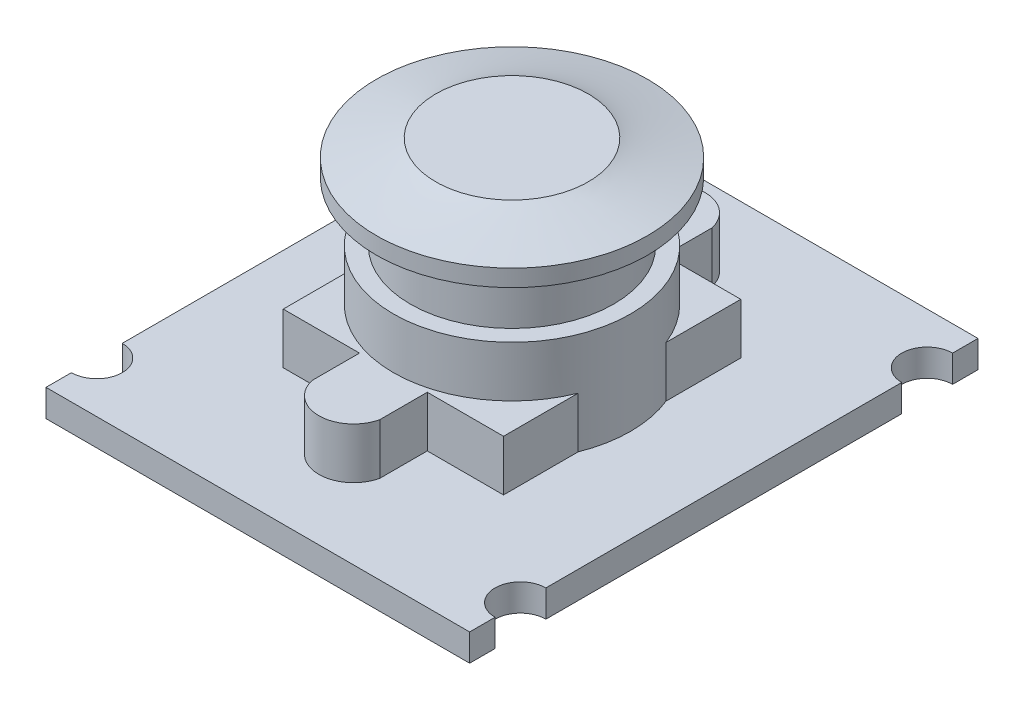
from build123d import *

# Parameters (mm, degrees)
SKETCH1_W               = 25
SKETCH1_H               = 30
BOSS_EXTRUDE1_DEPTH     = 1.6
BOSS_EXTRUDE2_DEPTH     = 3
SKETCH3_R               = 7
BOSS_EXTRUDE3_DEPTH     = 3
BOSS_EXTRUDE4_START     = 3
SKETCH4_R               = 7
BOSS_EXTRUDE4_DEPTH     = 3
SKETCH5_R               = 6
BOSS_EXTRUDE5_DEPTH     = 3.5
SKETCH6_R               = 8
BOSS_EXTRUDE6_DEPTH     = 1
SKETCH10_R              = 1.5
CUT_EXTRUDE1_DEPTH      = 2
MIRROR2_COPY_1_SKETCH_R = 1.5
MIRROR2_COPY_1_DEPTH    = 2
SKETCH11_W              = 4.4
SKETCH11_H              = 7.4
BOSS_EXTRUDE7_DEPTH     = 3.2
CUT_EXTRUDE2_DEPTH      = 3
SKETCH13_W              = 7.4
SKETCH13_H              = 0.01
CUT_EXTRUDE3_DEPTH      = 3


with BuildPart() as part:
    # Sketch1 → Boss-Extrude1 (new body)
    with BuildSketch(Plane(origin=(0, 0, 0), x_dir=(1, 0, 0), z_dir=(0, 1, 0))):
        Rectangle(SKETCH1_W, SKETCH1_H)
    extrude(amount=BOSS_EXTRUDE1_DEPTH)

    # Sketch2 → Boss-Extrude2 (add)
    with BuildSketch(Plane(origin=(0, 1.6, 0), x_dir=(1, 0, 0), z_dir=(0, 1, 0))):
        with BuildLine():
            Line((2, -9.8), (2, -7))
            Line((2, -7), (6.5, -7))
            Line((6.5, -7), (6.5, 7))
            Line((6.5, 7), (2, 7))
            Line((2, 7), (2, 9.8))
            ThreePointArc((2, 9.8), (0, 11.4), (-2, 9.8))
            Line((-2, 9.8), (-2, 7))
            Line((-2, 7), (-6.5, 7))
            Line((-6.5, 7), (-6.5, -7))
            Line((-6.5, -7), (-2, -7))
            Line((-2, -7), (-2, -9.8))
            ThreePointArc((-2, -9.8), (0, -11.4), (2, -9.8))
        make_face()
    extrude(amount=BOSS_EXTRUDE2_DEPTH)

    # Sketch3 → Boss-Extrude3 (add)
    with BuildSketch(Plane(origin=(0, 4.6, 0), x_dir=(1, 0, 0), z_dir=(0, 1, 0))):
        Circle(SKETCH3_R)
    extrude(amount=-BOSS_EXTRUDE3_DEPTH)

    # Sketch4 → Boss-Extrude4 (add)
    with BuildSketch(Plane(origin=(0, 4.6, 0), x_dir=(1, 0, 0), z_dir=(0, 1, 0)).offset(BOSS_EXTRUDE4_START)):
        with Locations(Location((0, 0, 0), (0, 0, 270))):
            Circle(SKETCH4_R)
    extrude(amount=-BOSS_EXTRUDE4_DEPTH)

    # Sketch5 → Boss-Extrude5 (add)
    with BuildSketch(Plane(origin=(0, 7.6, 0), x_dir=(1, 0, 0), z_dir=(0, 1, 0))):
        with Locations(Location((0, 0, 0), (0, 0, 270))):
            Circle(SKETCH5_R)
    extrude(amount=BOSS_EXTRUDE5_DEPTH)

    # Sketch6 → Boss-Extrude6 (add)
    with BuildSketch(Plane(origin=(0, 11.1, 0), x_dir=(1, 0, 0), z_dir=(0, 1, 0))):
        with Locations(Location((0, 0, 0), (0, 0, 270))):
            Circle(SKETCH6_R)
    extrude(amount=BOSS_EXTRUDE6_DEPTH)

    # Loft1: read off the stored shape, not the designer's step
    # Loft1: loft between two sections, ruled curve by curve
    loft1_from = [
        Edge.make_bspline([(-7.29329327, 12.1, -3.287533007), (-13.868359284, 12.1, 11.299053534), (0.718227257, 12.1, 17.874119548), (7.29329327, 12.1, 3.287533007), (13.868359284, 12.1, -11.299053534), (-0.718227257, 12.1, -17.874119548), (-7.29329327, 12.1, -3.287533007)], [0, 0, 0, 0, 0.5, 0.5, 0.5, 1, 1, 1, 1], 3, [1, 0.333333333, 0.333333333, 1, 0.333333333, 0.333333333, 1]),
    ]
    loft1_to = [
        Edge.make_bspline([(-4.457852082, 13.1, 0.614454893), (-3.228942297, 13.1, 9.530159057), (5.686761867, 13.1, 8.301249271), (4.457852082, 13.1, -0.614454893), (3.228942297, 13.1, -9.530159057), (-5.686761867, 13.1, -8.301249271), (-4.457852082, 13.1, 0.614454893)], [0, 0, 0, 0, 0.5, 0.5, 0.5, 1, 1, 1, 1], 3, [1, 0.333333333, 0.333333333, 1, 0.333333333, 0.333333333, 1]),
    ]
    loft1 = Solid(Shell([*[Face.make_surface_from_curves(loft1_from[k], loft1_to[k]) for k in range(1)], Face(Wire(loft1_from)), Face(Wire(loft1_to))]))
    add(loft1)

    # Sketch10 → Cut-Extrude1 (cut)
    with BuildSketch(Plane(origin=(0, 1.6, 0), x_dir=(1, 0, 0), z_dir=(0, 1, 0))):
        with Locations((12.5, -12)):
            Circle(SKETCH10_R)
    cut_extrude1 = extrude(amount=-CUT_EXTRUDE1_DEPTH, mode=Mode.SUBTRACT)

    # Mirror1: Cut-Extrude1 across plane
    add(cut_extrude1.mirror(Plane.ZY), mode=Mode.SUBTRACT)

    # Mirror2: Cut-Extrude1 across plane
    add(cut_extrude1.mirror(Plane.XY), mode=Mode.SUBTRACT)

    # Mirror2 copy 1 sketch → Mirror2 copy 1 (cut)
    with BuildSketch(Plane(origin=(0, 1.6, 0), x_dir=(-1, 0, 0), z_dir=(0, 1, 0))):
        with Locations((12.5, -12)):
            Circle(MIRROR2_COPY_1_SKETCH_R)
    extrude(amount=-MIRROR2_COPY_1_DEPTH, mode=Mode.SUBTRACT)

    # Sketch11 → Boss-Extrude7 (add)
    with BuildSketch(Plane(origin=(0, 0, 0), x_dir=(-1, 0, 0), z_dir=(0, -1, 0))):
        with Locations((10.3, 5.5)):
            Rectangle(SKETCH11_W, SKETCH11_H)
    extrude(amount=BOSS_EXTRUDE7_DEPTH)

    # Sketch12 → Cut-Extrude2 (cut)
    with BuildSketch(Plane.ZY.offset(12.5)):
        Polygon((-8.4, -2.7), (-2.6, -2.7), (-2.6, -2.4), (-2.5, -2.4), (-2.5, -1.9), (-2.6, -1.9), (-2.6, -0.5), (-8.4, -0.5), (-8.4, -1.9), (-8.5, -1.9), (-8.5, -2.4), (-8.4, -2.4), align=None)
    extrude(amount=-CUT_EXTRUDE2_DEPTH, mode=Mode.SUBTRACT)

    # Sketch13 → Cut-Extrude3 (cut)
    with BuildSketch(Plane.ZY.offset(12.5)):
        with Locations((-5.5, -0.005)):
            Rectangle(SKETCH13_W, SKETCH13_H)
    extrude(amount=-CUT_EXTRUDE3_DEPTH, mode=Mode.SUBTRACT)


solid = part.part
